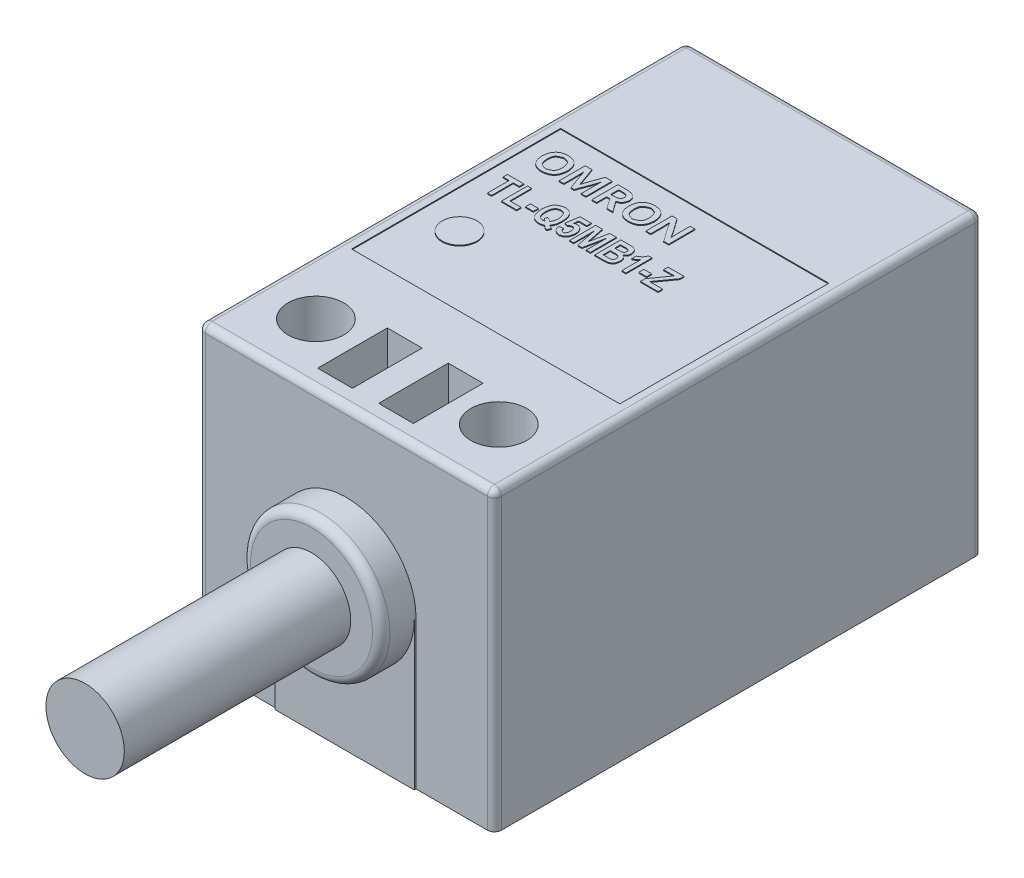
from build123d import *

# Parameters (mm, degrees)
SKETCH_2_W            = 17
SKETCH_2_H            = 17
EXTRUDE_1_DEPTH       = 28
SKETCH_3_R            = 1.6
CUT_EXTRUDE_1_DEPTH   = 28
SKETCH_3_3_W          = 2
SKETCH_3_3_H          = 4
CUT_EXTRUDE_2_DEPTH   = 3
SKETCH_3_4_W          = 15.4
SKETCH_3_4_H          = 12
SKETCH_3_4_R          = 1
CUT_EXTRUDE_3_DEPTH   = 0.05
SKETCH_4_R            = 4
EXTRUDE_2_DEPTH       = 2
SKETCH_4_3_R          = 2.25
EXTRUDE_3_DEPTH       = 15
FILLET_1_R            = 0.4
FILLET_2_R            = 0.5
SKETCH_5_R            = 7
SKETCH_5_R_2          = 6.5
SKETCH_5_R_3          = 4.25
SKETCH_5_R_4          = 3.75
SKETCH_5_W            = 13.5
SKETCH_5_H            = 0.5
SKETCH_5_W_2          = 0.5
SKETCH_5_H_2          = 13.5
CUT_EXTRUDE_1_2_DEPTH = 0.15
CUT_EXTRUDE_4_DEPTH   = 0.1
EXTRUDE_5_DEPTH       = 8.5
SKETCH_6_6_W          = 15.5
SKETCH_6_6_H          = 20.75
CUT_EXTRUDE_5_DEPTH   = 0.4
CUT_EXTRUDE_5_DRAFT   = -40
FILLET_3_R            = 6
WRAP_1_OUTLINE_W      = 0.448051948
WRAP_1_OUTLINE_H      = 0.292207793
WRAP_1_DEPTH          = 0.05


# Read off the part's stored shape, not the designer's step: Перенос1
with BuildPart() as part:
    # Эскиз2 → Бобышка-Вытянуть1 (new body)
    with BuildSketch(Plane.XY):
        Rectangle(SKETCH_2_W, SKETCH_2_H)
    extrude(amount=-EXTRUDE_1_DEPTH)

    # Эскиз3 → Cut-Extrude 1 (cut)
    with BuildSketch(Plane(origin=(0, 8.5, 0), x_dir=(1, 0, 0), z_dir=(0, 1, 0))):
        with Locations(Location((-5.25, 3.5, 0), (0, 0, 270))):
            Circle(SKETCH_3_R)
        with Locations(Location((5.25, 3.5, 0), (0, 0, 270))):
            Circle(SKETCH_3_R)
    extrude(amount=-CUT_EXTRUDE_1_DEPTH, mode=Mode.SUBTRACT)

    # Эскиз3<3> → Вырез-Вытянуть2 (cut)
    with BuildSketch(Plane(origin=(0, 8.5, 0), x_dir=(1, 0, 0), z_dir=(0, 1, 0))):
        with Locations((1.75, 3.1)):
            Rectangle(SKETCH_3_3_W, SKETCH_3_3_H)
        with Locations((-1.75, 3.1)):
            Rectangle(SKETCH_3_3_W, SKETCH_3_3_H)
    extrude(amount=-CUT_EXTRUDE_2_DEPTH, mode=Mode.SUBTRACT)

    # Эскиз3<4> → Вырез-Вытянуть3 (cut)
    with BuildSketch(Plane(origin=(0, 8.5, 0), x_dir=(1, 0, 0), z_dir=(0, 1, 0))):
        with Locations((0, 14)):
            Rectangle(SKETCH_3_4_W, SKETCH_3_4_H)
        with Locations(Location((-5.5, 12, 0), (0, 0, 270))):
            Circle(SKETCH_3_4_R, mode=Mode.SUBTRACT)
    extrude(amount=-CUT_EXTRUDE_3_DEPTH, mode=Mode.SUBTRACT)

    # Эскиз4 → Бобышка-Вытянуть2 (add)
    with BuildSketch(Plane.XY):
        Circle(SKETCH_4_R)
    extrude(amount=EXTRUDE_2_DEPTH)

    # Эскиз4<3> → Бобышка-Вытянуть3 (add)
    with BuildSketch(Plane.XY):
        Circle(SKETCH_4_3_R)
    extrude(amount=EXTRUDE_3_DEPTH)

    # Скругление1
    fillet_1_edges = [part.edges().sort_by_distance(p)[0] for p in [
        (-8.5, 0, -28),
        (8.5, 0, -28),
        (-8.5, 0, 0),
        (0, 8.5, 0),
        (8.5, 0, 0),
        (-8.5, 8.5, -14),
        (8.5, 8.5, -14),
        (0, 8.5, -28),
    ]]
    fillet(fillet_1_edges, radius=FILLET_1_R)

    # Скругление2
    fillet_2_edges = [part.edges().sort_by_distance(p)[0] for p in [
        (-4, 0, 2),
    ]]
    fillet(fillet_2_edges, radius=FILLET_2_R)

    # Эскиз5 → Cut-Extrude 1 2 (cut)
    # profile 1 of 4: a face of its own
    with BuildSketch(Plane(origin=(0, 0, -28), x_dir=(-1, 0, 0), z_dir=(0, 0, -1))):
        Circle(SKETCH_5_R)
        Circle(SKETCH_5_R_2, mode=Mode.SUBTRACT)
    # profile 2 of 4: a face of its own
    with BuildSketch(Plane(origin=(0, 0, -28), x_dir=(-1, 0, 0), z_dir=(0, 0, -1))):
        Circle(SKETCH_5_R_3)
        Circle(SKETCH_5_R_4, mode=Mode.SUBTRACT)
    # profile 3 of 4: a face of its own
    with BuildSketch(Plane(origin=(0, 0, -28), x_dir=(-1, 0, 0), z_dir=(0, 0, -1))):
        Rectangle(SKETCH_5_W, SKETCH_5_H)
    # profile 4 of 4: a face of its own
    with BuildSketch(Plane(origin=(0, 0, -28), x_dir=(-1, 0, 0), z_dir=(0, 0, -1))):
        Rectangle(SKETCH_5_W_2, SKETCH_5_H_2)
    extrude(amount=-CUT_EXTRUDE_1_2_DEPTH, mode=Mode.SUBTRACT)

    # Эскиз6 → Вырез-Вытянуть4 (cut)
    with BuildSketch(Plane.XZ.offset(8.5)):
        Polygon((0, -6.5), (0, 0), (-4, 0), (-4, -0.8), (-2.5, -0.8), (-2.5, -5.5), (-3, -5.5), (-3, -6.5), align=None)
        Polygon((4, 0), (0, 0), (0, -6.5), (3, -6.5), (3, -5.5), (2.5, -5.5), (2.5, -0.8), (4, -0.8), align=None)
        Polygon((-4, 0), (0, 0), (4, 0), (4, 0.1), (-4, 0.1), align=None)
    extrude(amount=-CUT_EXTRUDE_4_DEPTH, mode=Mode.SUBTRACT)


with BuildPart() as body_2:
    # Эскиз6<5> → Бобышка-Вытянуть5 (new body)
    with BuildSketch(Plane.XZ.offset(8.5)):
        Polygon((-3, -6.5), (0, -6.5), (3, -6.5), (3, -5.5), (2.5, -5.5), (2.5, -0.8), (4, -0.8), (4, 0), (4, 0.1), (-4, 0.1), (-4, 0), (-4, -0.8), (-2.5, -0.8), (-2.5, -5.5), (-3, -5.5), align=None)
    extrude(amount=-EXTRUDE_5_DEPTH)


with BuildPart() as cut_extrude_5_tool:
    # Эскиз6<6> → Вырез-Вытянуть5 (with draft: the straight prism first)
    with BuildSketch(Plane.XZ.offset(8.5)):
        with Locations((0, -16.875)):
            Rectangle(SKETCH_6_6_W, SKETCH_6_6_H)
    extrude(amount=-CUT_EXTRUDE_5_DEPTH)
    # Вырез-Вытянуть5: the draft: its side faces are tilted about the plane it starts from
    cut_extrude_5_sides = [cut_extrude_5_tool.faces().sort_by_distance(p)[0] for p in [
        (-7.75, -8.3, -16.875),
        (0, -8.3, -27.25),
        (7.75, -8.3, -16.875),
        (0, -8.3, -6.5),
    ]]
    draft(cut_extrude_5_sides, Plane.XZ.offset(8.5), CUT_EXTRUDE_5_DRAFT)


with BuildPart() as part_1:
    add(part.part)

    # Вырез-Вытянуть5: cut by cut_extrude_5_tool
    add(cut_extrude_5_tool.part, mode=Mode.SUBTRACT)

    # Скругление3
    # the kernel refuses this fillet: 6 mm, written as the material it adds along each edge
    with BuildSketch(Plane(origin=(-7.414360148, -8.1, -2.289574677), x_dir=(-0.6427876096862393, -0.7660444431192299, 0), z_dir=(0, 0, -1))) as fillet_3_piece_1_section:
        with BuildLine():
            CenterArc((3.427404912, -5.249720845), FILLET_3_R, 118.960530219, 21.039469781)
            Line((-1.168861747, -1.392995186), (0, 0))
            Line((0, 0), (0.522162916, 0))
        make_face()
    fillet_3_piece_1 = extrude(amount=29.170850647, mode=Mode.PRIVATE)
    fillet_3_piece_1 = split(fillet_3_piece_1, bisect_by=Plane(origin=(-6.693570082, -3.208836369, -10.939813451), z_dir=(0, -0.6427876096865398, -0.7660444431189778)), keep=Keep.TOP, mode=Mode.PRIVATE)
    fillet_3_piece_1 = split(fillet_3_piece_1, bisect_by=Plane(origin=(-6.693570082, -8.189049214, -28), z_dir=(0, 0, 1)), keep=Keep.TOP, mode=Mode.PRIVATE)
    add(fillet_3_piece_1)
    with BuildSketch(Plane(origin=(11.960425323, -8.1, -6.835639852), x_dir=(0, -0.7660444431192246, 0.6427876096862456), z_dir=(-1, 0, 0))) as fillet_3_piece_2_section:
        with BuildLine():
            CenterArc((3.427404912, -5.249720845), FILLET_3_R, 118.960530219, 21.039469781)
            Line((-1.168861747, -1.392995186), (0, 0))
            Line((0, 0), (0.522162916, 0))
        make_face()
    fillet_3_piece_2 = extrude(amount=8.960425416, mode=Mode.PRIVATE)
    fillet_3_piece_2 = split(fillet_3_piece_2, bisect_by=Plane(origin=(6.615593819, -7.148067358, -7.556429918), z_dir=(-0.7660444431189775, -0.64278760968654, 0)), keep=Keep.TOP, mode=Mode.PRIVATE)
    add(fillet_3_piece_2)
    with BuildSketch(Plane(origin=(2.999999907, -8.1, -6.835639852), x_dir=(0, -0.7660444431192313, 0.6427876096862376), z_dir=(-1, 0, 0))) as fillet_3_piece_3:
        with BuildLine():
            CenterArc((3.427404912, -5.249720845), FILLET_3_R, 118.960530219, 21.039469781)
            Line((-1.168861747, -1.392995186), (0, 0))
            Line((0, 0), (0.522162916, 0))
        make_face()
    extrude(amount=5.999999796)
    with BuildSketch(Plane(origin=(-2.999999889, -8.1, -6.835639852), x_dir=(0, -0.7660444431192316, 0.6427876096862373), z_dir=(-1, 0, 0))) as fillet_3_piece_4_section:
        with BuildLine():
            CenterArc((3.427404912, -5.249720845), FILLET_3_R, 118.960530219, 21.039469781)
            Line((-1.168861747, -1.392995186), (0, 0))
            Line((0, 0), (0.522162916, 0))
        make_face()
    fillet_3_piece_4 = extrude(amount=8.960425435, mode=Mode.PRIVATE)
    fillet_3_piece_4 = split(fillet_3_piece_4, bisect_by=Plane(origin=(-6.615593815, -7.148067354, -7.556429918), z_dir=(0.766044443118978, -0.6427876096865395, 0)), keep=Keep.TOP, mode=Mode.PRIVATE)
    add(fillet_3_piece_4)
    with BuildSketch(Plane(origin=(7.414360148, -8.1, -31.460425323), x_dir=(0.6427876096862418, -0.7660444431192275, 0), z_dir=(0, 0, 1))) as fillet_3_piece_5_section:
        with BuildLine():
            CenterArc((3.427404912, -5.249720845), FILLET_3_R, 118.960530219, 21.039469781)
            Line((-1.168861747, -1.392995186), (0, 0))
            Line((0, 0), (0.522162916, 0))
        make_face()
    fillet_3_piece_5 = extrude(amount=29.170850647, mode=Mode.PRIVATE)
    fillet_3_piece_5 = split(fillet_3_piece_5, bisect_by=Plane(origin=(6.693570082, -3.208836369, -10.939813451), z_dir=(0, -0.6427876096865398, -0.7660444431189778)), keep=Keep.TOP, mode=Mode.PRIVATE)
    fillet_3_piece_5 = split(fillet_3_piece_5, bisect_by=Plane(origin=(6.693570082, -8.189049214, -28), z_dir=(0, 0, 1)), keep=Keep.TOP, mode=Mode.PRIVATE)
    add(fillet_3_piece_5)
    with BuildSketch(Plane(origin=(-11.960425323, -8.1, -26.914360148), x_dir=(0, -0.7660444431192254, -0.6427876096862446), z_dir=(1, 0, 0))) as fillet_3_piece_6_section:
        with BuildLine():
            CenterArc((3.427404912, -5.249720845), FILLET_3_R, 118.960530219, 21.039469781)
            Line((-1.168861747, -1.392995186), (0, 0))
            Line((0, 0), (0.522162916, 0))
        make_face()
    fillet_3_piece_6 = extrude(amount=23.920850647, mode=Mode.PRIVATE)
    fillet_3_piece_6 = split(fillet_3_piece_6, bisect_by=Plane(origin=(-4.394773316, -4.501396545, -26.193570082), z_dir=(0.766044443118978, -0.6427876096865395, 0)), keep=Keep.TOP, mode=Mode.PRIVATE)
    fillet_3_piece_6 = split(fillet_3_piece_6, bisect_by=Plane(origin=(4.394773316, -4.501396545, -26.193570082), z_dir=(-0.7660444431189775, -0.64278760968654, 0)), keep=Keep.TOP, mode=Mode.PRIVATE)
    add(fillet_3_piece_6)

    # Перенос1 outline → Перенос1 (add)
    # profile 1 of 15: a face of its own
    with BuildSketch(Plane(origin=(0, 8.45, 0), x_dir=(1, 0, 0), z_dir=(0, 1, 0))):
        with BuildLine():
            add(Edge.make_bspline(
                [(-6.126507915, 17.325865723), (-5.991440987, 17.341007155), (-5.722027464, 17.371209266), (-5.425399401, 17.694354206), (-5.399881121, 17.962424745), (-5.387071295, 18.096992484)],
                knots=[0, 0, 0, 0, 0.333637162, 0.665494984, 1, 1, 1, 1], degree=3))
            add(Edge.make_bspline(
                [(-5.387071295, 18.096992484), (-5.399881153, 18.231549804), (-5.425399825, 18.499603057), (-5.721988731, 18.82278916), (-5.991421102, 18.852981528), (-6.126507915, 18.868119244)],
                knots=[0, 0, 0, 0, 0.334481944, 0.666325495, 1, 1, 1, 1], degree=3))
            add(Edge.make_bspline(
                [(-6.126507915, 18.868119244), (-6.261592514, 18.852973875), (-6.531024167, 18.822765829), (-6.827586003, 18.499576727), (-6.853125041, 18.231536894), (-6.865944534, 18.096992484)],
                knots=[0, 0, 0, 0, 0.333678667, 0.665535491, 1, 1, 1, 1], degree=3))
            add(Edge.make_bspline(
                [(-6.865944534, 18.096992484), (-6.853125041, 17.962437678), (-6.827586331, 17.694380594), (-6.530985565, 17.371232376), (-6.261572675, 17.341014733), (-6.126507915, 17.325865723)],
                knots=[0, 0, 0, 0, 0.334487558, 0.666358657, 1, 1, 1, 1], degree=3))
        make_face()
        with BuildLine():
            add(Edge.make_bspline(
                [(-5.682845943, 18.096992484), (-5.691492071, 17.972844812), (-5.710724405, 17.696692355), (-5.978896063, 17.607406442), (-6.126507915, 17.558260089)],
                knots=[0, 0, 0, 0, 0.449562075, 1, 1, 1, 1], degree=3))
            add(Edge.make_bspline(
                [(-6.126507915, 17.558260089), (-6.245803621, 17.586612954), (-6.51793165, 17.651289289), (-6.551382978, 17.936700226), (-6.570169886, 18.096992484)],
                knots=[0, 0, 0, 0, 0.438380813, 1, 1, 1, 1], degree=3))
            add(Edge.make_bspline(
                [(-6.570169886, 18.096992484), (-6.561521358, 18.221197746), (-6.542290627, 18.497378591), (-6.274091405, 18.586618392), (-6.126507915, 18.635724878)],
                knots=[0, 0, 0, 0, 0.449724393, 1, 1, 1, 1], degree=3))
            add(Edge.make_bspline(
                [(-6.126507915, 18.635724878), (-6.007241418, 18.607406221), (-5.735089552, 18.542786437), (-5.701637905, 18.257344019), (-5.682845943, 18.096992484)],
                knots=[0, 0, 0, 0, 0.438235086, 1, 1, 1, 1], degree=3))
        make_face(mode=Mode.SUBTRACT)
    # profile 2 of 15: a face of its own
    with BuildSketch(Plane(origin=(0, 8.45, 0), x_dir=(1, 0, 0), z_dir=(0, 1, 0))):
        with BuildLine():
            Line((-4.858902281, 17.346992484), (-4.858902281, 18.108216075))
            add(Edge.make_bspline(
                [(-4.858902281, 18.108216075), (-4.859414545, 18.165008279), (-4.860578769, 18.294079952), (-4.868179975, 18.422939306), (-4.872436612, 18.495099878)],
                knots=[0, 0, 0, 0, 0.440005168, 1, 1, 1, 1], degree=3))
            Line((-4.872436612, 18.495099878), (-4.862203337, 18.495099878))
            add(Edge.make_bspline(
                [(-4.862203337, 18.495099878), (-4.848691898, 18.450709428), (-4.817984278, 18.349822685), (-4.782847913, 18.250387292), (-4.763171647, 18.194703751)],
                knots=[0, 0, 0, 0, 0.440002809, 1, 1, 1, 1], degree=3))
            Line((-4.763171647, 18.194703751), (-4.451221823, 17.346992484))
            Line((-4.451221823, 17.346992484), (-4.273624992, 17.346992484))
            Line((-4.273624992, 17.346992484), (-3.961675168, 18.194703751))
            add(Edge.make_bspline(
                [(-3.961675168, 18.194703751), (-3.946270712, 18.238470538), (-3.911260753, 18.337940031), (-3.880095791, 18.438683659), (-3.862643478, 18.495099878)],
                knots=[0, 0, 0, 0, 0.440002113, 1, 1, 1, 1], degree=3))
            add(Edge.make_bspline(
                [(-3.862643478, 18.495099878), (-3.861810557, 18.438240058), (-3.859916316, 18.308928559), (-3.863779845, 18.179655756), (-3.865944534, 18.107225758)],
                knots=[0, 0, 0, 0, 0.439712019, 1, 1, 1, 1], degree=3))
            Line((-3.865944534, 18.107225758), (-3.865944534, 17.346992484))
            Line((-3.865944534, 17.346992484), (-3.591296647, 17.346992484))
            Line((-3.591296647, 17.346992484), (-3.591296647, 18.846992484))
            Line((-3.591296647, 18.846992484), (-3.977850344, 18.846992484))
            Line((-3.977850344, 18.846992484), (-4.237643478, 18.129342836))
            add(Edge.make_bspline(
                [(-4.237643478, 18.129342836), (-4.257124976, 18.074108392), (-4.301400057, 17.948578546), (-4.339036598, 17.820893527), (-4.360112668, 17.749391251)],
                knots=[0, 0, 0, 0, 0.44001045, 1, 1, 1, 1], degree=3))
            add(Edge.make_bspline(
                [(-4.360112668, 17.749391251), (-4.379040838, 17.806078172), (-4.421779045, 17.934072442), (-4.465279424, 18.061809786), (-4.489514076, 18.132973998)],
                knots=[0, 0, 0, 0, 0.442886396, 1, 1, 1, 1], degree=3))
            Line((-4.489514076, 18.132973998), (-4.748977105, 18.846992484))
            Line((-4.748977105, 18.846992484), (-5.133550168, 18.846992484))
            Line((-5.133550168, 18.846992484), (-5.133550168, 17.346992484))
            Line((-5.133550168, 17.346992484), (-4.858902281, 17.346992484))
        make_face()
    # profile 3 of 15: a face of its own
    with BuildSketch(Plane(origin=(0, 8.45, 0), x_dir=(1, 0, 0), z_dir=(0, 1, 0))):
        with BuildLine():
            Line((-2.049043126, 17.346992484), (-2.486763196, 17.954056744))
            add(Edge.make_bspline(
                [(-2.486763196, 17.954056744), (-2.399206984, 17.988571823), (-2.203042984, 18.065900611), (-2.158314471, 18.275435835), (-2.133550168, 18.391446709)],
                knots=[0, 0, 0, 0, 0.446341902, 1, 1, 1, 1], degree=3))
            add(Edge.make_bspline(
                [(-2.133550168, 18.391446709), (-2.142053718, 18.471457264), (-2.161289963, 18.652452562), (-2.322104278, 18.743844475), (-2.411829217, 18.794835793)],
                knots=[0, 0, 0, 0, 0.442058749, 1, 1, 1, 1], degree=3))
            add(Edge.make_bspline(
                [(-2.411829217, 18.794835793), (-2.46664692, 18.809725554), (-2.591314911, 18.843588274), (-2.720641031, 18.845770053), (-2.793101224, 18.846992484)],
                knots=[0, 0, 0, 0, 0.439709521, 1, 1, 1, 1], degree=3))
            Line((-2.793101224, 18.846992484), (-3.253268478, 18.846992484))
            Line((-3.253268478, 18.846992484), (-3.253268478, 17.346992484))
            Line((-3.253268478, 17.346992484), (-2.978620591, 17.346992484))
            Line((-2.978620591, 17.346992484), (-2.978620591, 17.917415019))
            Line((-2.978620591, 17.917415019), (-2.791780802, 17.917415019))
            Line((-2.791780802, 17.917415019), (-2.387071295, 17.346992484))
            Line((-2.387071295, 17.346992484), (-2.049043126, 17.346992484))
        make_face()
        with BuildLine():
            add(Edge.make_bspline(
                [(-2.429324816, 18.397058505), (-2.433301183, 18.35451342), (-2.442271214, 18.258538681), (-2.527682553, 18.210534469), (-2.575231506, 18.183810265)],
                knots=[0, 0, 0, 0, 0.443294613, 1, 1, 1, 1], degree=3))
            add(Edge.make_bspline(
                [(-2.575231506, 18.183810265), (-2.613884092, 18.173577673), (-2.70181564, 18.15029934), (-2.792894628, 18.149985352), (-2.843937492, 18.149809385)],
                knots=[0, 0, 0, 0, 0.439575855, 1, 1, 1, 1], degree=3))
            Line((-2.843937492, 18.149809385), (-2.978620591, 18.149809385))
            Line((-2.978620591, 18.149809385), (-2.978620591, 18.614598117))
            Line((-2.978620591, 18.614598117), (-2.783528161, 18.614598117))
            add(Edge.make_bspline(
                [(-2.783528161, 18.614598117), (-2.746990006, 18.614579486), (-2.664134975, 18.614537236), (-2.584241456, 18.592131804), (-2.539580098, 18.57960692)],
                knots=[0, 0, 0, 0, 0.440988969, 1, 1, 1, 1], degree=3))
            add(Edge.make_bspline(
                [(-2.539580098, 18.57960692), (-2.510084718, 18.56157113), (-2.443111923, 18.520618707), (-2.43427172, 18.441392709), (-2.429324816, 18.397058505)],
                knots=[0, 0, 0, 0, 0.440408379, 1, 1, 1, 1], degree=3))
        make_face(mode=Mode.SUBTRACT)
    # profile 4 of 15: a face of its own
    with BuildSketch(Plane(origin=(0, 8.45, 0), x_dir=(1, 0, 0), z_dir=(0, 1, 0))):
        with BuildLine():
            add(Edge.make_bspline(
                [(-1.140592422, 17.325865723), (-1.005525494, 17.341007155), (-0.736111971, 17.371209266), (-0.439483908, 17.694354206), (-0.413965628, 17.962424745), (-0.401155802, 18.096992484)],
                knots=[0, 0, 0, 0, 0.333637162, 0.665494984, 1, 1, 1, 1], degree=3))
            add(Edge.make_bspline(
                [(-0.401155802, 18.096992484), (-0.41396566, 18.231549804), (-0.439484332, 18.499603057), (-0.736073238, 18.82278916), (-1.005505609, 18.852981528), (-1.140592422, 18.868119244)],
                knots=[0, 0, 0, 0, 0.334481944, 0.666325495, 1, 1, 1, 1], degree=3))
            add(Edge.make_bspline(
                [(-1.140592422, 18.868119244), (-1.275677021, 18.852973875), (-1.545108674, 18.822765829), (-1.84167051, 18.499576727), (-1.867209548, 18.231536894), (-1.880029041, 18.096992484)],
                knots=[0, 0, 0, 0, 0.333678667, 0.665535491, 1, 1, 1, 1], degree=3))
            add(Edge.make_bspline(
                [(-1.880029041, 18.096992484), (-1.867209548, 17.962437678), (-1.841670838, 17.694380594), (-1.545070072, 17.371232376), (-1.275657182, 17.341014733), (-1.140592422, 17.325865723)],
                knots=[0, 0, 0, 0, 0.334487558, 0.666358657, 1, 1, 1, 1], degree=3))
        make_face()
        with BuildLine():
            add(Edge.make_bspline(
                [(-0.69693045, 18.096992484), (-0.705576578, 17.972844812), (-0.724808912, 17.696692355), (-0.99298057, 17.607406442), (-1.140592422, 17.558260089)],
                knots=[0, 0, 0, 0, 0.449562075, 1, 1, 1, 1], degree=3))
            add(Edge.make_bspline(
                [(-1.140592422, 17.558260089), (-1.259888128, 17.586612954), (-1.532016157, 17.651289289), (-1.565467485, 17.936700226), (-1.584254393, 18.096992484)],
                knots=[0, 0, 0, 0, 0.438380813, 1, 1, 1, 1], degree=3))
            add(Edge.make_bspline(
                [(-1.584254393, 18.096992484), (-1.575605865, 18.221197746), (-1.556375134, 18.497378591), (-1.288175912, 18.586618392), (-1.140592422, 18.635724878)],
                knots=[0, 0, 0, 0, 0.449724393, 1, 1, 1, 1], degree=3))
            add(Edge.make_bspline(
                [(-1.140592422, 18.635724878), (-1.021325925, 18.607406221), (-0.749174059, 18.542786437), (-0.715722412, 18.257344019), (-0.69693045, 18.096992484)],
                knots=[0, 0, 0, 0, 0.438235086, 1, 1, 1, 1], degree=3))
        make_face(mode=Mode.SUBTRACT)
    # profile 5 of 15: a face of its own
    with BuildSketch(Plane(origin=(0, 8.45, 0), x_dir=(1, 0, 0), z_dir=(0, 1, 0))):
        with BuildLine():
            Line((0.127013212, 17.346992484), (0.127013212, 18.026349878))
            add(Edge.make_bspline(
                [(0.127013212, 18.026349878), (0.126180796, 18.089034022), (0.12428893, 18.231498875), (0.117359424, 18.373811248), (0.113478881, 18.453506568)],
                knots=[0, 0, 0, 0, 0.439997255, 1, 1, 1, 1], degree=3))
            add(Edge.make_bspline(
                [(0.113478881, 18.453506568), (0.152999682, 18.391308767), (0.241981264, 18.251269633), (0.335065235, 18.113919892), (0.386806346, 18.03757347)],
                knots=[0, 0, 0, 0, 0.444145854, 1, 1, 1, 1], degree=3))
            Line((0.386806346, 18.03757347), (0.874702473, 17.346992484))
            Line((0.874702473, 17.346992484), (1.16222448, 17.346992484))
            Line((1.16222448, 17.346992484), (1.16222448, 18.846992484))
            Line((1.16222448, 18.846992484), (0.887576593, 18.846992484))
            Line((0.887576593, 18.846992484), (0.887576593, 18.167635089))
            add(Edge.make_bspline(
                [(0.887576593, 18.167635089), (0.888563236, 18.105103168), (0.890805636, 17.962983343), (0.89719996, 17.820987301), (0.900780818, 17.741468716)],
                knots=[0, 0, 0, 0, 0.439994358, 1, 1, 1, 1], degree=3))
            add(Edge.make_bspline(
                [(0.900780818, 17.741468716), (0.86208767, 17.802525314), (0.774938564, 17.940043923), (0.683336689, 18.074641434), (0.632404938, 18.149479279)],
                knots=[0, 0, 0, 0, 0.443987898, 1, 1, 1, 1], degree=3))
            Line((0.632404938, 18.149479279), (0.139887332, 18.846992484))
            Line((0.139887332, 18.846992484), (-0.147634675, 18.846992484))
            Line((-0.147634675, 18.846992484), (-0.147634675, 17.346992484))
            Line((-0.147634675, 17.346992484), (0.127013212, 17.346992484))
        make_face()
    # profile 6 of 15: a face of its own
    with BuildSketch(Plane(origin=(0, 8.45, 0), x_dir=(1, 0, 0), z_dir=(0, 1, 0))):
        with BuildLine():
            add(Edge.make_bspline(
                [(-4.22482509, 15.432419463), (-4.213700065, 15.270144536), (-4.195511717, 15.004840622), (-3.940848731, 14.705803535), (-3.734845212, 14.677223134), (-3.631886779, 14.662938944)],
                knots=[0, 0, 0, 0, 0.440669582, 0.720452427, 1, 1, 1, 1], degree=3))
            add(Edge.make_bspline(
                [(-3.631886779, 14.662938944), (-3.589404508, 14.664574021), (-3.492968241, 14.668285703), (-3.404041792, 14.706431053), (-3.354289376, 14.727772548)],
                knots=[0, 0, 0, 0, 0.440521728, 1, 1, 1, 1], degree=3))
            add(Edge.make_bspline(
                [(-3.354289376, 14.727772548), (-3.329338181, 14.708640712), (-3.272636424, 14.665163487), (-3.215125399, 14.622761686), (-3.182921681, 14.599018489)],
                knots=[0, 0, 0, 0, 0.440042716, 1, 1, 1, 1], degree=3))
            add(Edge.make_bspline(
                [(-3.182921681, 14.599018489), (-3.16719862, 14.589957845), (-3.131478664, 14.569373696), (-3.093037663, 14.554424659), (-3.07151746, 14.546055827)],
                knots=[0, 0, 0, 0, 0.440175807, 1, 1, 1, 1], degree=3))
            Line((-3.07151746, 14.546055827), (-2.978071844, 14.75242758))
            add(Edge.make_bspline(
                [(-2.978071844, 14.75242758), (-3.010081856, 14.767773143), (-3.082820946, 14.802644178), (-3.146405429, 14.852405463), (-3.182008532, 14.880268489)],
                knots=[0, 0, 0, 0, 0.440066166, 1, 1, 1, 1], degree=3))
            add(Edge.make_bspline(
                [(-3.182008532, 14.880268489), (-3.140441811, 14.955722816), (-3.04590485, 15.127331797), (-3.039885897, 15.324032117), (-3.036513402, 15.434245762)],
                knots=[0, 0, 0, 0, 0.439687512, 1, 1, 1, 1], degree=3))
            add(Edge.make_bspline(
                [(-3.036513402, 15.434245762), (-3.047665754, 15.596137023), (-3.065899454, 15.860823479), (-3.320292733, 16.158578874), (-3.525624898, 16.18746494), (-3.628234181, 16.201899983)],
                knots=[0, 0, 0, 0, 0.440678759, 0.720494101, 1, 1, 1, 1], degree=3))
            add(Edge.make_bspline(
                [(-3.628234181, 16.201899983), (-3.792070015, 16.156982786), (-4.167015112, 16.05418792), (-4.204000705, 15.656393705), (-4.22482509, 15.432419463)],
                knots=[0, 0, 0, 0, 0.436959532, 1, 1, 1, 1], degree=3))
        make_face()
        with BuildLine():
            add(Edge.make_bspline(
                [(-3.270279636, 15.436376444), (-3.271832942, 15.375450512), (-3.275346185, 15.237649169), (-3.34692603, 15.11902868), (-3.38685837, 15.052853717)],
                knots=[0, 0, 0, 0, 0.442128725, 1, 1, 1, 1], degree=3))
            add(Edge.make_bspline(
                [(-3.38685837, 15.052853717), (-3.418994635, 15.080431108), (-3.492000689, 15.143080471), (-3.578754859, 15.184952791), (-3.627321032, 15.208393489)],
                knots=[0, 0, 0, 0, 0.44018631, 1, 1, 1, 1], degree=3))
            Line((-3.627321032, 15.208393489), (-3.698851064, 15.033373197))
            add(Edge.make_bspline(
                [(-3.698851064, 15.033373197), (-3.674285957, 15.02177627), (-3.618454393, 14.995418778), (-3.568920361, 14.958482007), (-3.54118061, 14.937796898)],
                knots=[0, 0, 0, 0, 0.439986016, 1, 1, 1, 1], degree=3))
            add(Edge.make_bspline(
                [(-3.54118061, 14.937796898), (-3.556004292, 14.932159254), (-3.589678208, 14.919352613), (-3.625715295, 14.917322262), (-3.645888402, 14.916185697)],
                knots=[0, 0, 0, 0, 0.44021261, 1, 1, 1, 1], degree=3))
            add(Edge.make_bspline(
                [(-3.645888402, 14.916185697), (-3.704193467, 14.926333534), (-3.821112785, 14.946683022), (-3.976309881, 15.140912968), (-3.985159284, 15.318008772), (-3.991058857, 15.436072061)],
                knots=[0, 0, 0, 0, 0.249011474, 0.499343442, 1, 1, 1, 1], degree=3))
            add(Edge.make_bspline(
                [(-3.991058857, 15.436072061), (-3.984573219, 15.555946159), (-3.974841706, 15.73581379), (-3.807317298, 15.922794757), (-3.689093581, 15.940041398), (-3.63006048, 15.94865323)],
                knots=[0, 0, 0, 0, 0.500097385, 0.750381716, 1, 1, 1, 1], degree=3))
            add(Edge.make_bspline(
                [(-3.63006048, 15.94865323), (-3.571050296, 15.940131338), (-3.45288932, 15.92306725), (-3.286028053, 15.735728775), (-3.276578223, 15.556102551), (-3.270279636, 15.436376444)],
                knots=[0, 0, 0, 0, 0.249631296, 0.499857415, 1, 1, 1, 1], degree=3))
        make_face(mode=Mode.SUBTRACT)
    # profile 7 of 15: a face of its own
    with BuildSketch(Plane(origin=(0, 8.45, 0), x_dir=(1, 0, 0), z_dir=(0, 1, 0))):
        with BuildLine():
            add(Edge.make_bspline(
                [(-2.177848629, 15.580349658), (-2.210043121, 15.610095719), (-2.283031555, 15.677533291), (-2.382501487, 15.688998474), (-2.438096194, 15.695406476)],
                knots=[0, 0, 0, 0, 0.441090323, 1, 1, 1, 1], degree=3))
            add(Edge.make_bspline(
                [(-2.438096194, 15.695406476), (-2.464977537, 15.693128248), (-2.52606583, 15.687950937), (-2.578942156, 15.656437471), (-2.60855074, 15.638791217)],
                knots=[0, 0, 0, 0, 0.440040836, 1, 1, 1, 1], degree=3))
            Line((-2.60855074, 15.638791217), (-2.566850253, 15.909692191))
            Line((-2.566850253, 15.909692191), (-2.101448467, 15.909692191))
            Line((-2.101448467, 15.909692191), (-2.101448467, 16.162938944))
            Line((-2.101448467, 16.162938944), (-2.74430561, 16.162938944))
            Line((-2.74430561, 16.162938944), (-2.861188727, 15.403198684))
            Line((-2.861188727, 15.403198684), (-2.666992298, 15.364237645))
            add(Edge.make_bspline(
                [(-2.666992298, 15.364237645), (-2.645001958, 15.387978526), (-2.595297057, 15.441640188), (-2.522706782, 15.454480638), (-2.482231746, 15.461640243)],
                knots=[0, 0, 0, 0, 0.442417935, 1, 1, 1, 1], degree=3))
            add(Edge.make_bspline(
                [(-2.482231746, 15.461640243), (-2.451139148, 15.456696605), (-2.38882481, 15.446788796), (-2.303903099, 15.345202234), (-2.299313439, 15.250698207), (-2.296253662, 15.187695437)],
                knots=[0, 0, 0, 0, 0.249223136, 0.499481416, 1, 1, 1, 1], degree=3))
            add(Edge.make_bspline(
                [(-2.296253662, 15.187695437), (-2.299265702, 15.124190616), (-2.303783186, 15.02894556), (-2.379657303, 14.918005925), (-2.442471956, 14.903779719), (-2.473709019, 14.896705178)],
                knots=[0, 0, 0, 0, 0.5014475, 0.752075114, 1, 1, 1, 1], degree=3))
            add(Edge.make_bspline(
                [(-2.473709019, 14.896705178), (-2.516848601, 14.911868892), (-2.615692678, 14.946612933), (-2.63565376, 15.051743556), (-2.646903012, 15.110990892)],
                knots=[0, 0, 0, 0, 0.436440736, 1, 1, 1, 1], degree=3))
            Line((-2.646903012, 15.110990892), (-2.880669246, 15.072029853))
            add(Edge.make_bspline(
                [(-2.880669246, 15.072029853), (-2.859871532, 14.974070688), (-2.813227041, 14.754370809), (-2.591826411, 14.695538994), (-2.469143272, 14.662938944)],
                knots=[0, 0, 0, 0, 0.44587719, 1, 1, 1, 1], degree=3))
            add(Edge.make_bspline(
                [(-2.469143272, 14.662938944), (-2.357734848, 14.695451607), (-2.101984143, 14.770088123), (-2.064284234, 15.040731315), (-2.043006908, 15.193478717)],
                knots=[0, 0, 0, 0, 0.435613362, 1, 1, 1, 1], degree=3))
            add(Edge.make_bspline(
                [(-2.043006908, 15.193478717), (-2.045849446, 15.255928282), (-2.052286808, 15.397354893), (-2.132856174, 15.514777308), (-2.177848629, 15.580349658)],
                knots=[0, 0, 0, 0, 0.441568709, 1, 1, 1, 1], degree=3))
        make_face()
    # profile 8 of 15: a face of its own
    with BuildSketch(Plane(origin=(0, 8.45, 0), x_dir=(1, 0, 0), z_dir=(0, 1, 0))):
        with BuildLine():
            add(Edge.make_bspline(
                [(0.340921663, 14.700986833), (0.411112807, 14.741047803), (0.571176708, 14.832402847), (0.593698304, 15.018417971), (0.606343741, 15.122861833)],
                knots=[0, 0, 0, 0, 0.438519515, 1, 1, 1, 1], degree=3))
            add(Edge.make_bspline(
                [(0.606343741, 15.122861833), (0.602226607, 15.191014592), (0.59297037, 15.34423722), (0.468871963, 15.437929507), (0.399971988, 15.489947872)],
                knots=[0, 0, 0, 0, 0.44479565, 1, 1, 1, 1], degree=3))
            add(Edge.make_bspline(
                [(0.399971988, 15.489947872), (0.443845849, 15.526047603), (0.543577744, 15.60810773), (0.558836531, 15.737816022), (0.567382702, 15.810463295)],
                knots=[0, 0, 0, 0, 0.43991805, 1, 1, 1, 1], degree=3))
            add(Edge.make_bspline(
                [(0.567382702, 15.810463295), (0.541918461, 15.918773955), (0.484018109, 16.165049719), (0.22374253, 16.176182702), (0.07793465, 16.182419463)],
                knots=[0, 0, 0, 0, 0.439794233, 1, 1, 1, 1], degree=3))
            Line((0.07793465, 16.182419463), (-0.426123792, 16.182419463))
            Line((-0.426123792, 16.182419463), (-0.426123792, 14.682419463))
            Line((-0.426123792, 14.682419463), (-0.006683857, 14.682419463))
            add(Edge.make_bspline(
                [(-0.006683857, 14.682419463), (0.044475746, 14.682282092), (0.160663527, 14.681970111), (0.276237194, 14.694162805), (0.340921663, 14.700986833)],
                knots=[0, 0, 0, 0, 0.440318273, 1, 1, 1, 1], degree=3))
        make_face()
        with BuildLine():
            Line((-0.192357558, 15.344757126), (0.023145689, 15.344757126))
            add(Edge.make_bspline(
                [(0.023145689, 15.344757126), (0.103868265, 15.350838219), (0.224345945, 15.359914192), (0.360623976, 15.256232715), (0.368582865, 15.176146396), (0.372577507, 15.135950308)],
                knots=[0, 0, 0, 0, 0.502826589, 0.750463913, 1, 1, 1, 1], degree=3))
            add(Edge.make_bspline(
                [(0.372577507, 15.135950308), (0.369339747, 15.098823947), (0.362892026, 15.024889972), (0.244943354, 14.917892977), (0.131060858, 14.928537983), (0.054801533, 14.935666217)],
                knots=[0, 0, 0, 0, 0.249941461, 0.497737059, 1, 1, 1, 1], degree=3))
            Line((0.054801533, 14.935666217), (-0.192357558, 14.935666217))
            Line((-0.192357558, 14.935666217), (-0.192357558, 15.344757126))
        make_face(mode=Mode.SUBTRACT)
        with BuildLine():
            Line((-0.192357558, 15.92917271), (-0.035600253, 15.92917271))
            add(Edge.make_bspline(
                [(-0.035600253, 15.92917271), (0.040347983, 15.934717877), (0.153197579, 15.942957304), (0.314906673, 15.887810811), (0.327363988, 15.807330545), (0.333616468, 15.766936509)],
                knots=[0, 0, 0, 0, 0.506205784, 0.752158603, 1, 1, 1, 1], degree=3))
            add(Edge.make_bspline(
                [(0.333616468, 15.766936509), (0.328369436, 15.729285083), (0.316504414, 15.644144574), (0.232722148, 15.617651264), (0.185990656, 15.602874009)],
                knots=[0, 0, 0, 0, 0.442226923, 1, 1, 1, 1], degree=3))
            add(Edge.make_bspline(
                [(0.185990656, 15.602874009), (0.156779333, 15.601249192), (0.090377888, 15.597555756), (0.023869649, 15.597843), (-0.013380285, 15.598003879)],
                knots=[0, 0, 0, 0, 0.439920009, 1, 1, 1, 1], degree=3))
            Line((-0.013380285, 15.598003879), (-0.192357558, 15.598003879))
            Line((-0.192357558, 15.598003879), (-0.192357558, 15.92917271))
        make_face(mode=Mode.SUBTRACT)
    # profile 9 of 15: a face of its own
    with BuildSketch(Plane(origin=(0, 8.45, 0), x_dir=(1, 0, 0), z_dir=(0, 1, 0))):
        with BuildLine():
            Line((0.820629455, 15.812289593), (0.820629455, 15.55904284))
            add(Edge.make_bspline(
                [(0.820629455, 15.55904284), (0.871933042, 15.582135741), (0.988484548, 15.634598203), (1.080695941, 15.72353815), (1.132317767, 15.773328554)],
                knots=[0, 0, 0, 0, 0.440179522, 1, 1, 1, 1], degree=3))
            Line((1.132317767, 15.773328554), (1.132317767, 14.682419463))
            Line((1.132317767, 14.682419463), (1.366084001, 14.682419463))
            Line((1.366084001, 14.682419463), (1.366084001, 16.182419463))
            Line((1.366084001, 16.182419463), (1.174018254, 16.182419463))
            add(Edge.make_bspline(
                [(1.174018254, 16.182419463), (1.140540117, 16.111524087), (1.064422958, 15.950333676), (0.908162723, 15.861853874), (0.820629455, 15.812289593)],
                knots=[0, 0, 0, 0, 0.439823778, 1, 1, 1, 1], degree=3))
        make_face()
    # profile 10 of 15: a face of its own
    with BuildSketch(Plane(origin=(0, 8.45, 0), x_dir=(1, 0, 0), z_dir=(0, 1, 0))):
        Polygon((-5.997552363, 15.92917271), (-5.997552363, 16.182419463), (-6.932617298, 16.182419463), (-6.932617298, 15.92917271), (-6.581967947, 15.92917271), (-6.581967947, 14.682419463), (-6.348201714, 14.682419463), (-6.348201714, 15.92917271), align=None)
    # profile 11 of 15: a face of its own
    with BuildSketch(Plane(origin=(0, 8.45, 0), x_dir=(1, 0, 0), z_dir=(0, 1, 0))):
        Polygon((-5.549500415, 14.935666217), (-5.549500415, 16.182419463), (-5.783266649, 16.182419463), (-5.783266649, 14.682419463), (-4.906643272, 14.682419463), (-4.906643272, 14.935666217), align=None)
    # profile 12 of 15: a face of its own
    with BuildSketch(Plane(origin=(0, 8.45, 0), x_dir=(1, 0, 0), z_dir=(0, 1, 0))):
        Polygon((-0.679370545, 14.682419463), (-0.679370545, 16.182419463), (-1.062284506, 16.182419463), (-1.273526389, 15.139602905), (-1.480811292, 16.182419463), (-1.867682233, 16.182419463), (-1.867682233, 14.682419463), (-1.633915999, 14.682419463), (-1.633915999, 15.882602093), (-1.39467087, 14.682419463), (-1.156947655, 14.682419463), (-0.913136779, 15.882602093), (-0.913136779, 14.682419463), align=None)
    # profile 13 of 15: a face of its own
    with BuildSketch(Plane(origin=(0, 8.45, 0), x_dir=(1, 0, 0), z_dir=(0, 1, 0))):
        Polygon((3.197252832, 15.947435697), (3.197252832, 16.182419463), (2.281668416, 16.182419463), (2.281668416, 15.92917271), (2.90413189, 15.92917271), (2.203746338, 14.956059885), (2.203746338, 14.682419463), (3.216733351, 14.682419463), (3.216733351, 14.935666217), (2.468864033, 14.935666217), align=None)
    # profile 14 of 15: a face of its own
    with BuildSketch(Plane(origin=(0, 8.45, 0), x_dir=(1, 0, 0), z_dir=(0, 1, 0))):
        with Locations((-4.585214701, 15.237614268)):
            Rectangle(WRAP_1_OUTLINE_W, WRAP_1_OUTLINE_H)
    # profile 15 of 15: a face of its own
    with BuildSketch(Plane(origin=(0, 8.45, 0), x_dir=(1, 0, 0), z_dir=(0, 1, 0))):
        with Locations((1.921278806, 15.237614268)):
            Rectangle(WRAP_1_OUTLINE_W, WRAP_1_OUTLINE_H)
    extrude(amount=WRAP_1_DEPTH)


solid = Compound([body_2.part, part_1.part])
